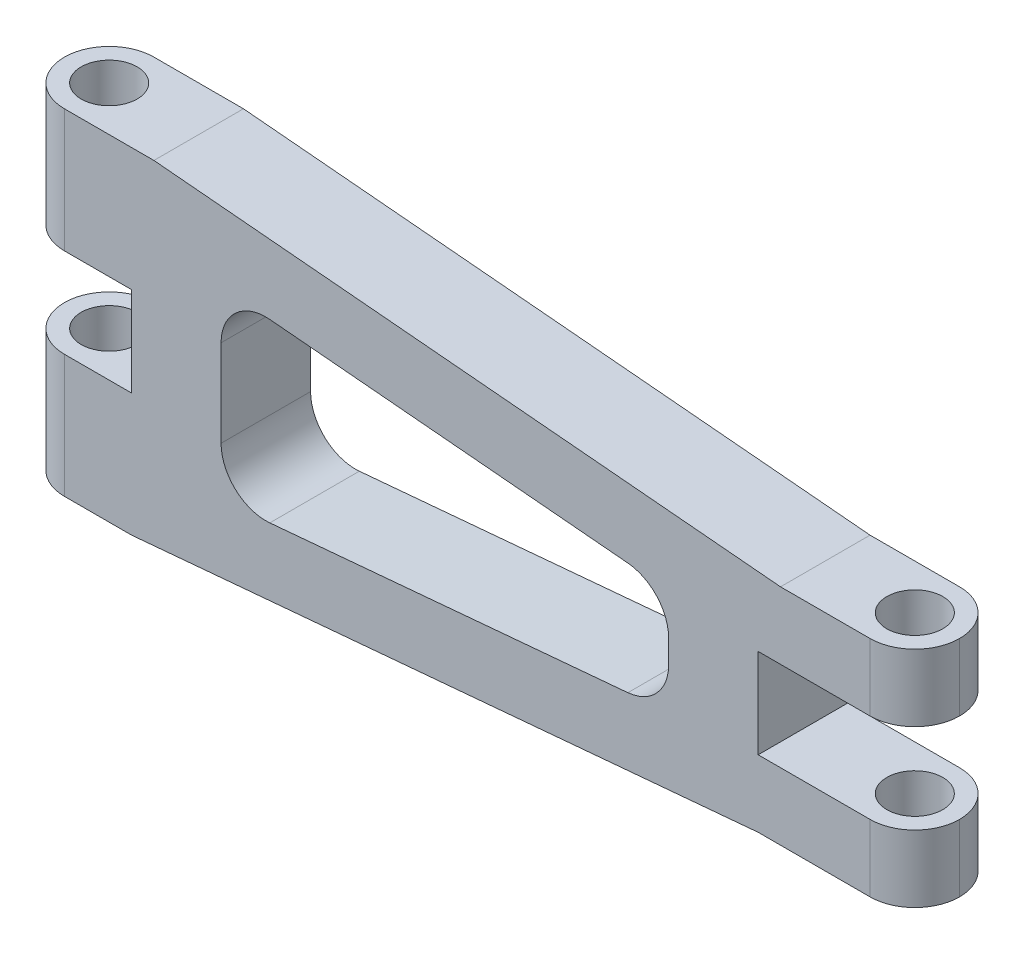
from build123d import *

# Parameters (mm, degrees)
BASE_EXTRUDE_DEPTH      = 20
FILLET1_R               = 10
FILLET2_R               = 10
CUT_EXTRUDE1_DEPTH      = 181.430735794
CUT_EXTRUDE1_DEPTH_BACK = 181.430735794
SKETCH4_R               = 6.25


with BuildPart() as part:
    # Sketch1 → Base-Extrude (new body)
    with BuildSketch(Plane.XY):
        Polygon((145.351370521, 25), (5.351370521, 37.5), (-24.64607099, 37.5), (-24.64607099, 10), (0.35392901, 10), (0.35392901, -10), (-24.64607099, -10), (-24.64607099, -37.5), (0.35392901, -37.5), (140.35392901, -25), (175.35392901, -25), (175.35392901, -10), (140.35392901, -10), (140.35392901, 10), (175.35392901, 10), (175.35392901, 25), align=None)
        Polygon((120.35392901, 11.726043432), (20.35392901, 20.65461486), (20.35392901, -20.65461486), (120.35392901, -11.726043432), align=None, mode=Mode.SUBTRACT)
    extrude(amount=BASE_EXTRUDE_DEPTH)

    # Fillet1
    # the kernel refuses this fillet: 10 mm, written as the material it takes off along each edge
    with BuildSketch(Plane(origin=(175.35392901, -15, 0), x_dir=(0, 0, 1), z_dir=(0, 1, 0)), Plane(origin=(175.35392901, -50, 0), x_dir=(0, 0, 1), z_dir=(0, 1, 0))) as fillet1_piece_1:
        with BuildLine():
            CenterArc((FILLET1_R, -FILLET1_R), FILLET1_R, 90, 90)
            Line((0, -FILLET1_R), (0, 0))
            Line((0, 0), (FILLET1_R, 0))
        make_face()
    extrude(amount=65, mode=Mode.SUBTRACT)
    with BuildSketch(Plane(origin=(-24.64607099, 15, 0), x_dir=(0, 0, 1), z_dir=(0, -1, 0)), Plane(origin=(-24.64607099, 62.5, 0), x_dir=(0, 0, 1), z_dir=(0, -1, 0))) as fillet1_piece_2:
        with BuildLine():
            CenterArc((FILLET1_R, -FILLET1_R), FILLET1_R, 90, 90)
            Line((0, -FILLET1_R), (0, 0))
            Line((0, 0), (FILLET1_R, 0))
        make_face()
    extrude(amount=77.5, mode=Mode.SUBTRACT)
    with BuildSketch(Plane(origin=(-24.64607099, 15, 20), x_dir=(0, 0, -1), z_dir=(0, -1, 0)), Plane(origin=(-24.64607099, 62.5, 20), x_dir=(0, 0, -1), z_dir=(0, -1, 0))) as fillet1_piece_3:
        with BuildLine():
            CenterArc((FILLET1_R, FILLET1_R), FILLET1_R, 180, 90)
            Line((0, FILLET1_R), (0, 0))
            Line((0, 0), (FILLET1_R, 0))
        make_face()
    extrude(amount=77.5, mode=Mode.SUBTRACT)
    with BuildSketch(Plane(origin=(175.35392901, -50, 20), x_dir=(0, 0, -1), z_dir=(0, 1, 0)), Plane(origin=(175.35392901, -15, 20), x_dir=(0, 0, -1), z_dir=(0, 1, 0))) as fillet1_piece_4:
        with BuildLine():
            CenterArc((FILLET1_R, FILLET1_R), FILLET1_R, 180, 90)
            Line((0, FILLET1_R), (0, 0))
            Line((0, 0), (FILLET1_R, 0))
        make_face()
    extrude(amount=65, mode=Mode.SUBTRACT)

    # Fillet2
    fillet2_edges = [part.edges().sort_by_distance(p)[0] for p in [
        (120.35392901, -11.726043432, 10),
        (120.35392901, 11.726043432, 10),
        (20.35392901, 20.65461486, 10),
        (20.35392901, -20.65461486, 10),
    ]]
    fillet(fillet2_edges, radius=FILLET2_R)

    # Sketch4 → Cut-Extrude1 (cut, two sides: drawn at the far end of the back side and taken through both)
    with BuildSketch(Plane(origin=(0, 0, 0), x_dir=(1, 0, 0), z_dir=(0, 1, 0)).offset(-CUT_EXTRUDE1_DEPTH_BACK)):
        with Locations((165.35392901, -10)):
            Circle(SKETCH4_R)
        with Locations(Location((-14.64607099, -10, 0), (0, 0, 270))):
            Circle(SKETCH4_R)
    extrude(amount=CUT_EXTRUDE1_DEPTH + CUT_EXTRUDE1_DEPTH_BACK, mode=Mode.SUBTRACT)


solid = part.part
